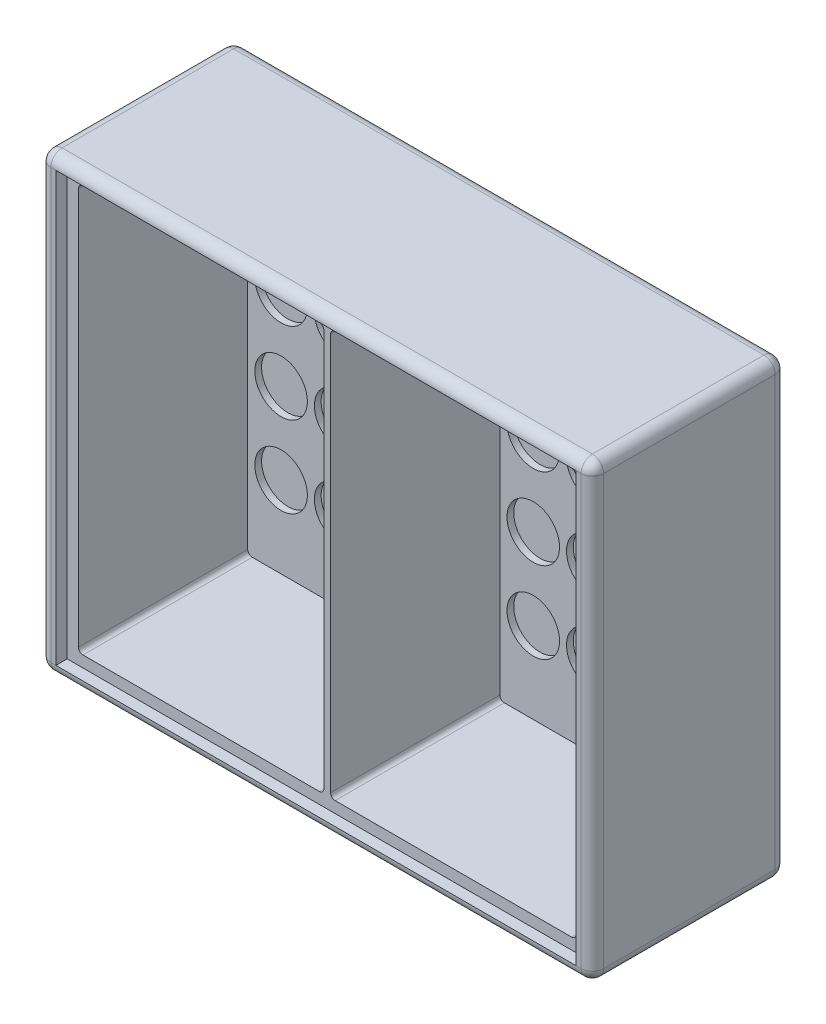
from build123d import *

# Parameters (mm, degrees)
SKETCH1_W           = 245
SKETCH1_H           = 200
BOSS_EXTRUDE1_DEPTH = 6
SKETCH2_W           = 245
SKETCH2_H           = 200
SKETCH2_W_2         = 220.5
SKETCH2_H_2         = 180
BOSS_EXTRUDE2_DEPTH = 80
SKETCH3_W           = 3
SKETCH3_H           = 180
BOSS_EXTRUDE3_DEPTH = 75
SKETCH5_W           = 230.5
SKETCH5_H           = 190
SKETCH5_W_2         = 220.5
SKETCH5_H_2         = 180
CUT_EXTRUDE1_DEPTH  = 5
SKETCH6_R           = 11.65
CUT_EXTRUDE2_DEPTH  = 3
FILLET1_R           = 5
FILLET2_R           = 2


with BuildPart() as part:
    # Sketch1 → Boss-Extrude1 (new body)
    with BuildSketch(Plane.XY):
        Rectangle(SKETCH1_W, SKETCH1_H)
    extrude(amount=BOSS_EXTRUDE1_DEPTH)

    # Sketch2 → Boss-Extrude2 (add)
    with BuildSketch(Plane.XY.offset(6)):
        Rectangle(SKETCH2_W, SKETCH2_H)
        Rectangle(SKETCH2_W_2, SKETCH2_H_2, mode=Mode.SUBTRACT)
    extrude(amount=BOSS_EXTRUDE2_DEPTH)

    # Sketch3 → Boss-Extrude3 (add)
    with BuildSketch(Plane.XY.offset(6)):
        Rectangle(SKETCH3_W, SKETCH3_H)
    extrude(amount=BOSS_EXTRUDE3_DEPTH)

    # Sketch5 → Cut-Extrude1 (cut)
    with BuildSketch(Plane.XY.offset(86)):
        Rectangle(SKETCH5_W, SKETCH5_H)
        Rectangle(SKETCH5_W_2, SKETCH5_H_2, mode=Mode.SUBTRACT)
    extrude(amount=-CUT_EXTRUDE1_DEPTH, mode=Mode.SUBTRACT)

    # Sketch6 → Cut-Extrude2 (cut)
    with BuildSketch(Plane.XY.offset(6)):
        with Locations((16.29, 54)):
            Circle(SKETCH6_R)
        with Locations((42.68, 54)):
            Circle(SKETCH6_R)
        with Locations((69.07, 54)):
            Circle(SKETCH6_R)
        with Locations((95.46, 54)):
            Circle(SKETCH6_R)
        with Locations((16.29, 18)):
            Circle(SKETCH6_R)
        with Locations((42.68, 18)):
            Circle(SKETCH6_R)
        with Locations((69.07, 18)):
            Circle(SKETCH6_R)
        with Locations((95.46, 18)):
            Circle(SKETCH6_R)
        with Locations((16.29, -18)):
            Circle(SKETCH6_R)
        with Locations((42.68, -18)):
            Circle(SKETCH6_R)
        with Locations((69.07, -18)):
            Circle(SKETCH6_R)
        with Locations((95.46, -18)):
            Circle(SKETCH6_R)
        with Locations((16.29, -54)):
            Circle(SKETCH6_R)
        with Locations((42.68, -54)):
            Circle(SKETCH6_R)
        with Locations((69.07, -54)):
            Circle(SKETCH6_R)
        with Locations((95.46, -54)):
            Circle(SKETCH6_R)
        with Locations(Location((-95.46, -54, 0), (0, 0, 180))):
            Circle(SKETCH6_R)
        with Locations(Location((-69.07, -54, 0), (0, 0, 180))):
            Circle(SKETCH6_R)
        with Locations(Location((-42.68, -54, 0), (0, 0, 180))):
            Circle(SKETCH6_R)
        with Locations(Location((-16.29, -54, 0), (0, 0, 180))):
            Circle(SKETCH6_R)
        with Locations(Location((-95.46, -18, 0), (0, 0, 180))):
            Circle(SKETCH6_R)
        with Locations(Location((-69.07, -18, 0), (0, 0, 180))):
            Circle(SKETCH6_R)
        with Locations(Location((-42.68, -18, 0), (0, 0, 180))):
            Circle(SKETCH6_R)
        with Locations(Location((-16.29, -18, 0), (0, 0, 180))):
            Circle(SKETCH6_R)
        with Locations(Location((-95.46, 18, 0), (0, 0, 180))):
            Circle(SKETCH6_R)
        with Locations(Location((-69.07, 18, 0), (0, 0, 180))):
            Circle(SKETCH6_R)
        with Locations(Location((-42.68, 18, 0), (0, 0, 180))):
            Circle(SKETCH6_R)
        with Locations(Location((-16.29, 18, 0), (0, 0, 180))):
            Circle(SKETCH6_R)
        with Locations(Location((-95.46, 54, 0), (0, 0, 180))):
            Circle(SKETCH6_R)
        with Locations(Location((-69.07, 54, 0), (0, 0, 180))):
            Circle(SKETCH6_R)
        with Locations(Location((-42.68, 54, 0), (0, 0, 180))):
            Circle(SKETCH6_R)
        with Locations(Location((-16.29, 54, 0), (0, 0, 180))):
            Circle(SKETCH6_R)
    extrude(amount=-CUT_EXTRUDE2_DEPTH, mode=Mode.SUBTRACT)

    # Fillet1
    fillet1_edges = [part.edges().sort_by_distance(p)[0] for p in [
        (122.5, 0, 86),
        (0, 100, 86),
        (-122.5, 0, 86),
        (0, -100, 86),
        (0, 100, 0),
        (122.5, 0, 0),
        (0, -100, 0),
        (-122.5, 0, 0),
        (-122.5, 100, 43),
        (122.5, 100, 43),
        (122.5, -100, 43),
        (-122.5, -100, 43),
    ]]
    fillet(fillet1_edges, radius=FILLET1_R - 0.0001)  # a hair under: the kernel refuses the full size

    # Fillet2
    fillet2_edges = [part.edges().sort_by_distance(p)[0] for p in [
        (1.5, -90, 43.5),
        (1.5, 90, 43.5),
        (-1.5, 90, 43.5),
        (-1.5, -90, 43.5),
        (-110.25, 90, 43.5),
        (-110.25, -90, 43.5),
        (110.25, -90, 43.5),
        (110.25, 90, 43.5),
    ]]
    fillet(fillet2_edges, radius=FILLET2_R)


solid = part.part
